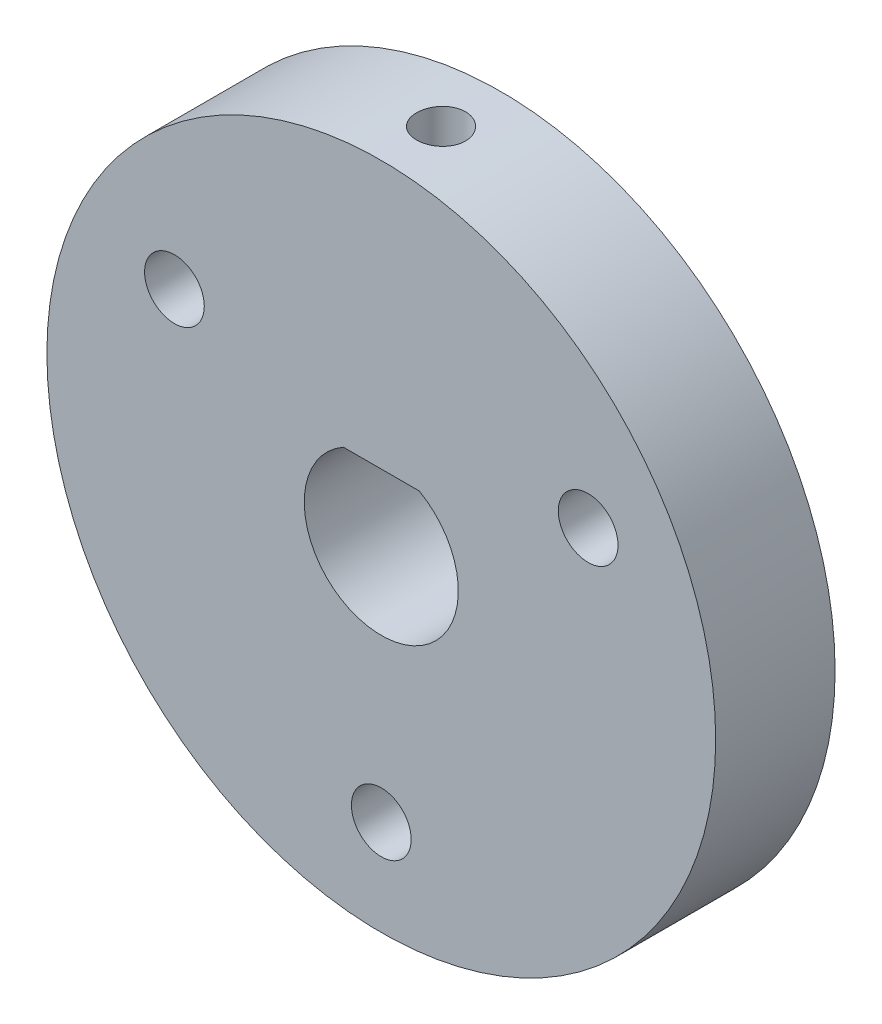
from build123d import *

# Parameters (mm, degrees)
SKETCH1_R              = 14
BOSS_EXTRUDE1_DEPTH    = 2.5
M2_5_CLEARANCE_HOLE2_D = 2.5
CIRPATTERN1_COUNT      = 3
SKETCH7_W              = 1.025
SKETCH7_H              = 11.192782739


with BuildPart() as part:
    # Sketch1 → Boss-Extrude1 (new, symmetric)
    with BuildSketch(Plane.XY):
        Circle(SKETCH1_R)
        with BuildLine():
            Line((-1.5875, 2.807217261), (1.5875, 2.807217261))
            ThreePointArc((1.5875, 2.807217261), (0, -3.225), (-1.5875, 2.807217261))
        make_face(mode=Mode.SUBTRACT)
    extrude(amount=BOSS_EXTRUDE1_DEPTH, both=True)

    # M2.5 Clearance Hole2 (through all)
    with Locations(Plane.XY.offset(2.5)):
        with Locations((0, -10)):
            m2_5_clearance_hole2 = Hole(M2_5_CLEARANCE_HOLE2_D / 2)

    # CirPattern1: M2.5 Clearance Hole2 ×3 about axis
    cirpattern1_axis = Axis((0, 0, 2.5), (0, 0, -1))
    for i in range(1, CIRPATTERN1_COUNT):
        add(m2_5_clearance_hole2.rotate(cirpattern1_axis, i * 360 / CIRPATTERN1_COUNT), mode=Mode.SUBTRACT)

    # Sketch7 → M2.5x0.45 Tapped Hole1 (revolve, cut)
    with BuildSketch(Plane(origin=(0, 2.807217261, 0), x_dir=(0, 0, -1), z_dir=(1, 0, 0))):
        with Locations((0.5125, 5.59639137)):
            Rectangle(SKETCH7_W, SKETCH7_H)
    revolve(axis=Axis((0, -3.542782739, 0), (0, 1, 0)), mode=Mode.SUBTRACT)


solid = part.part
